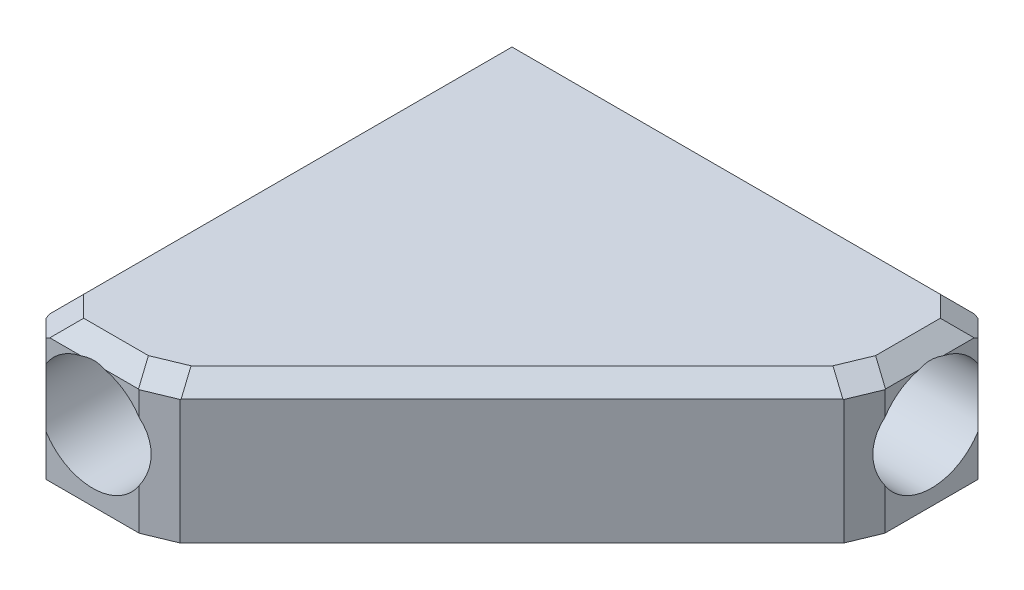
from build123d import *

# Parameters (mm, degrees)
SKETCH1_W           = 15
SKETCH1_H           = 10
SKETCH1_H_2         = 15
SKETCH1_W_2         = 10
BOSS_EXTRUDE1_DEPTH = 16.7
SKETCH2_R           = 6.5
CUT_EXTRUDE1_DEPTH  = 8.3
SKETCH3_R           = 6.5
CUT_EXTRUDE2_DEPTH  = 8.3
SKETCH4_R           = 6.5
CUT_EXTRUDE3_DEPTH  = 14.7
BOSS_EXTRUDE2_START = 32
SKETCH5_R           = 6.5
BOSS_EXTRUDE2_DEPTH = 32
BOSS_EXTRUDE3_START = 32
SKETCH6_R           = 6.5
BOSS_EXTRUDE3_DEPTH = 32
BOSS_EXTRUDE4_DEPTH = 16.7
CHAMFER1_SIZE       = 2
CHAMFER2_SIZE       = 2


with BuildPart() as part:
    # Sketch1 → Boss-Extrude1 (new body)
    with BuildSketch(Plane(origin=(0, 0, 0), x_dir=(1, 0, 0), z_dir=(0, 1, 0))):
        Rectangle(SKETCH1_W, SKETCH1_H)
        with Locations((0, 12.5)):
            Rectangle(SKETCH1_W, SKETCH1_H_2)
        with Locations((12.5, 12.5)):
            Rectangle(SKETCH1_W_2, SKETCH1_H_2)
    extrude(amount=BOSS_EXTRUDE1_DEPTH)

    # Sketch2 → Cut-Extrude1 (cut)
    with BuildSketch(Plane.XY.offset(5)):
        with Locations((0, 8.35)):
            Circle(SKETCH2_R)
    extrude(amount=-CUT_EXTRUDE1_DEPTH, mode=Mode.SUBTRACT)

    # Sketch3 → Cut-Extrude2 (cut)
    with BuildSketch(Plane(origin=(17.5, 0, 0), x_dir=(0, 0, -1), z_dir=(1, 0, 0))):
        with Locations((12.5, 8.35)):
            Circle(SKETCH3_R)
    extrude(amount=-CUT_EXTRUDE2_DEPTH, mode=Mode.SUBTRACT)

    # Sketch4 → Cut-Extrude3 (cut)
    with BuildSketch(Plane.XZ):
        with Locations(Location((0, -12.5, 0), (0, 0, 270))):
            Circle(SKETCH4_R)
    extrude(amount=-CUT_EXTRUDE3_DEPTH, mode=Mode.SUBTRACT)

    # Fillet8
    # the kernel refuses this chamfer: 2 mm, written as the material it adds along each edge
    with BuildSketch(Plane(origin=(7.5, 0, -5), x_dir=(-0.027495876610586494, 0, 0.9996219169112968), z_dir=(0, 1, 0))) as fillet8_piece_1:
        with BuildLine():
            Line((2.05734639, 0), (-0.11309431, 2.054235587))
            Line((-0.11309431, 2.054235587), (-0.153079186, 2.053135752))
            ThreePointArc((-0.153079186, 2.053135752), (-0.068258454, 1.026795659), (-0.039984877, -0.001099835))
            Line((-0.039984877, -0.001099835), (0.001099835, -0.039984877))
            ThreePointArc((0.001099835, -0.039984877), (1.028995329, -0.011711299), (2.058446225, -0.039984877))
            Line((2.058446225, -0.039984877), (2.05734639, 0))
        make_face()
    extrude(amount=16.7)
    # the kernel refuses this chamfer: 2 mm, written as the material it takes off along each edge
    with BuildSketch(Plane(origin=(-6.166666667, 1.333333333, -18.666666667), x_dir=(0.7071067811865471, 0, -0.707106781186548), z_dir=(-0.5773502691896263, -0.5773502691896255, -0.5773502691896254)), Plane(origin=(-6.166666667, 15.366666667, -18.666666667), x_dir=(0.7071067811865471, 0.7071067811865478, 0), z_dir=(-0.5773502691896261, 0.5773502691896256, -0.5773502691896256))) as fillet8_2_piece_1:
        Polygon((-1.414213562, -0.816496581), (1.414213562, -0.816496581), (0, 1.632993162), align=None)
    extrude(amount=2.540341184, mode=Mode.SUBTRACT)
    with BuildSketch(Plane(origin=(-7.5, 0, -25.143365976), x_dir=(-0.027495876610586494, 0.9996219169112968, 0), z_dir=(0, 0, 1)), Plane(origin=(22.643365976, 16.7, -20), x_dir=(0, 0.027495876610585647, 0.9996219169112968), z_dir=(-1, 0, 0)), Plane(origin=(-7.5, 16.7, 10.143365976), x_dir=(-0.027495876610586487, -0.9996219169112968, 0), z_dir=(0, 0, -1)), Plane(origin=(22.643365976, 0, -20), x_dir=(0, 0.9996219169112968, -0.02749587661058563), z_dir=(-1, 0, 0))) as fillet8_2_piece_2:
        with BuildLine():
            Line((2.05734639, 0), (-0.11309431, -2.054235587))
            Line((-0.11309431, -2.054235587), (-0.153079186, -2.053135752))
            ThreePointArc((-0.153079186, -2.053135752), (-0.068258454, -1.026795659), (-0.039984877, 0.001099835))
            Line((-0.039984877, 0.001099835), (0.001099835, 0.039984877))
            ThreePointArc((0.001099835, 0.039984877), (1.028995329, 0.011711299), (2.058446225, 0.039984877))
            Line((2.058446225, 0.039984877), (2.05734639, 0))
        make_face()
    extrude(amount=35.286731952, mode=Mode.SUBTRACT)
    with BuildSketch(Plane(origin=(-7.5, -5.143365976, -20), x_dir=(-0.02749587661058694, 0, 0.9996219169112968), z_dir=(0, 1, 0))) as fillet8_2_piece_3:
        with BuildLine():
            Line((2.05734639, 0), (-0.11309431, 2.054235587))
            Line((-0.11309431, 2.054235587), (-0.153079186, 2.053135752))
            ThreePointArc((-0.153079186, 2.053135752), (-0.068258454, 1.026795659), (-0.039984877, -0.001099835))
            Line((-0.039984877, -0.001099835), (0.001099835, -0.039984877))
            ThreePointArc((0.001099835, -0.039984877), (1.028995329, -0.011711299), (2.058446225, -0.039984877))
            Line((2.058446225, -0.039984877), (2.05734639, 0))
        make_face()
    extrude(amount=26.986731952, mode=Mode.SUBTRACT)

    # Sketch5 → Boss-Extrude2 (add)
    with BuildSketch(Plane.XY.offset(5).offset(BOSS_EXTRUDE2_START)):
        Polygon((-7.5, 14.7), (-7.5, 2), (-5.5, 0), (5.5, 0), (7.5, 0), (7.5, 16.7), (5.5, 16.7), (-5.5, 16.7), align=None)
        with Locations((0, 8.35)):
            Circle(SKETCH5_R, mode=Mode.SUBTRACT)
    extrude(amount=-BOSS_EXTRUDE2_DEPTH)

    # Sketch6 → Boss-Extrude3 (add)
    with BuildSketch(Plane(origin=(17.5, 0, 0), x_dir=(0, 0, -1), z_dir=(1, 0, 0)).offset(BOSS_EXTRUDE3_START)):
        Polygon((7, 0), (18, 0), (20, 2), (20, 14.7), (18, 16.7), (7, 16.7), (5, 16.7), (5, 0), align=None)
        with Locations((12.5, 8.35)):
            Circle(SKETCH6_R, mode=Mode.SUBTRACT)
    extrude(amount=-BOSS_EXTRUDE3_DEPTH)

    # Sketch7 → Boss-Extrude4 (add)
    with BuildSketch(Plane(origin=(0, 16.7, 0), x_dir=(1, 0, 0), z_dir=(0, 1, 0))):
        Polygon((7.5, -37), (7.5, 3), (9.5, 5), (49.5, 5), align=None)
    extrude(amount=-BOSS_EXTRUDE4_DEPTH)

    # Chamfer1
    # the kernel refuses this chamfer: 2 mm, written as the material it takes off along each edge
    with BuildSketch(Plane(origin=(49.5, 16.7, 0.143365976), x_dir=(-0.9996219169112968, 0.027495876610585647, 0), z_dir=(0, 0, -1)), Plane(origin=(-10.643365976, 16.7, 37), x_dir=(0, 0.027495876610585647, -0.9996219169112968), z_dir=(1, 0, 0))) as chamfer1_piece_1:
        Polygon((CHAMFER1_SIZE * 0.999621916911, -CHAMFER1_SIZE * 0.0274958766106), (-CHAMFER1_SIZE * 0.0274958766106, -CHAMFER1_SIZE * 0.999621916911), (0, 0), align=None)
    extrude(amount=23.286731952, mode=Mode.SUBTRACT)
    with BuildSketch(Plane(origin=(53.13690896, 16.7, -8.63690896), x_dir=(-0.7068394360706737, 0.027495876610585664, -0.7068394360706735), z_dir=(-0.7071067811865475, 0, 0.7071067811865476))) as chamfer1_piece_2:
        Polygon((CHAMFER1_SIZE * 0.999621916911, CHAMFER1_SIZE * 0.0274958766106), (-CHAMFER1_SIZE * 0.0274958766106, CHAMFER1_SIZE * 0.999621916911), (0, 0), align=None)
    extrude(amount=69.683701572, mode=Mode.SUBTRACT)

    # Chamfer2
    # the kernel refuses this chamfer: 2 mm, written as the material it takes off along each edge
    with BuildSketch(Plane(origin=(53.023839401, 11.176160599, -3.540377928), x_dir=(-0.5328158002121677, -0.1913765872198606, 0.8243071787315372), z_dir=(-0.6785983445455896, 0.6785983445461322, -0.2810846377147535))) as chamfer2_piece_1:
        Polygon((CHAMFER2_SIZE * 0.999945689414, -CHAMFER2_SIZE * 0.0104220066763), (-CHAMFER2_SIZE * 0.858936955191, -CHAMFER2_SIZE * 0.512081348037), (0, 0), align=None)
    extrude(amount=13.332892535, mode=Mode.SUBTRACT)
    with BuildSketch(Plane(origin=(44.512690686, 19.687309314, -15.012690686), x_dir=(0.4218381251250203, -0.39450595107904946, 0.816344076204527), z_dir=(0.5773502691895054, -0.5773502691899669, -0.577350269189405)), Plane(origin=(-10.487309314, 11.712690686, 39.987309314), x_dir=(0.8163440762039974, -0.3945059510795843, 0.4218381251255447), z_dir=(0.5773502691901542, 0.5773502691895923, -0.5773502691891308))) as chamfer2_piece_2:
        Polygon((CHAMFER2_SIZE * 0.999813220622, CHAMFER2_SIZE * 0.0193267656127), (-CHAMFER2_SIZE * 0.516644080304, CHAMFER2_SIZE * 0.856200265292), (0, 0), align=None)
    extrude(amount=13.812444634, mode=Mode.SUBTRACT)
    with BuildSketch(Plane(origin=(7.5, -5.185340786, 37), x_dir=(-0.9998910622590239, 0, 0.014760203742522883), z_dir=(0, 1, 0))) as chamfer2_piece_3:
        Polygon((CHAMFER2_SIZE * 0.999891062259, -CHAMFER2_SIZE * 0.0147602037425), (-CHAMFER2_SIZE * 0.717466790729, -CHAMFER2_SIZE * 0.696592710413), (0, 0), align=None)
    extrude(amount=25.070681572, mode=Mode.SUBTRACT)
    with BuildSketch(Plane(origin=(5.211950804, 20.223839401, 31.476160599), x_dir=(-0.959630861315162, -0.1913765872199142, 0.20611553040850397), z_dir=(0.2810846377147535, -0.6785983445461322, 0.6785983445455896))) as chamfer2_piece_4:
        Polygon((CHAMFER2_SIZE * 0.999945689414, CHAMFER2_SIZE * 0.0104220066763), (-CHAMFER2_SIZE * 0.858936955191, CHAMFER2_SIZE * 0.512081348037), (0, 0), align=None)
    extrude(amount=13.332892535, mode=Mode.SUBTRACT)
    with BuildSketch(Plane(origin=(49.5, -3.143365976, -20), x_dir=(0.027495876610585647, 0, 0.9996219169112968), z_dir=(0, 1, 0)), Plane(origin=(-7.5, 19.843365976, 37), x_dir=(0.9996219169112968, 0, 0.027495876610585623), z_dir=(0, -1, 0))) as chamfer2_piece_5:
        Polygon((CHAMFER2_SIZE * 0.999621916911, -CHAMFER2_SIZE * 0.0274958766106), (-CHAMFER2_SIZE * 0.0274958766106, -CHAMFER2_SIZE * 0.999621916911), (0, 0), align=None)
    extrude(amount=22.986731952, mode=Mode.SUBTRACT)
    with BuildSketch(Plane(origin=(49.5, 19.885340786, -5), x_dir=(-0.6965927104131439, 0, 0.7174667907292085), z_dir=(0, -1, 0))) as chamfer2_piece_6:
        Polygon((CHAMFER2_SIZE * 0.999891062259, CHAMFER2_SIZE * 0.0147602037425), (-CHAMFER2_SIZE * 0.717466790729, CHAMFER2_SIZE * 0.696592710413), (0, 0), align=None)
    extrude(amount=25.070681572, mode=Mode.SUBTRACT)


solid = part.part
